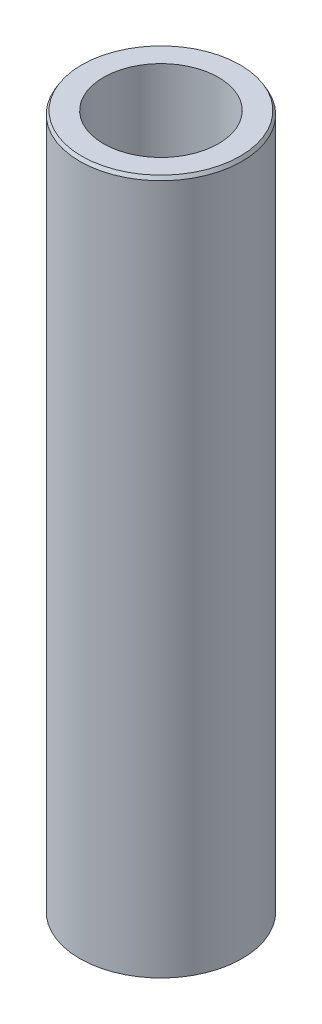
from build123d import *
from OCP.BRepFilletAPI import BRepFilletAPI_MakeChamfer

# Parameters (mm, degrees)
SKETCH1_R           = 27.5
BOSS_EXTRUDE1_DEPTH = 235.80241891
SKETCH2_R           = 19.487258292
CUT_EXTRUDE1_DEPTH  = 239.988034771
CHAMFER1_SIZE       = 1.16562229
CHAMFER1_SIZE2      = 0.672972343


with BuildPart() as part:
    # Sketch1 → Boss-Extrude1 (new body)
    with BuildSketch(Plane(origin=(0, 0, 0), x_dir=(1, 0, 0), z_dir=(0, 1, 0))):
        Circle(SKETCH1_R)
    extrude(amount=BOSS_EXTRUDE1_DEPTH)

    # Sketch2 → Cut-Extrude1 (cut, through all)
    with BuildSketch(Plane(origin=(0, 0, 0), x_dir=(1, 0, 0), z_dir=(0, 1, 0))):
        Circle(SKETCH2_R)
    extrude(amount=CUT_EXTRUDE1_DEPTH, mode=Mode.SUBTRACT)

    # Chamfer1: one chamfer whose edges measure the first distance from different faces: ONE call of the kernel's chamfer builder (chamfer() names one face for all edges)
    chamfer1_edges_1 = [part.edges().sort_by_distance(p)[0] for p in [
        (-27.5, 235.80241891, 0),
    ]]
    chamfer1_side_1 = [part.faces().sort_by_distance(p)[0] for p in [
        (-27.5, 117.901209455, 0),
    ]]
    chamfer1_edges_2 = [part.edges().sort_by_distance(p)[0] for p in [
        (-27.5, 0, 0),
    ]]
    chamfer1_side_2 = [part.faces().sort_by_distance(p)[0] for p in [
        (-26.722182541, 0, 0),
    ]]
    chamfer1 = BRepFilletAPI_MakeChamfer(part.part.solid().wrapped)
    for e in chamfer1_edges_1:
        chamfer1.Add(CHAMFER1_SIZE, CHAMFER1_SIZE2, e.wrapped, chamfer1_side_1[0].wrapped)  # the first distance lies on this face
    for e in chamfer1_edges_2:
        chamfer1.Add(CHAMFER1_SIZE, CHAMFER1_SIZE2, e.wrapped, chamfer1_side_2[0].wrapped)  # the first distance lies on this face
    add(Compound.cast(chamfer1.Shape()), mode=Mode.REPLACE)


solid = part.part
